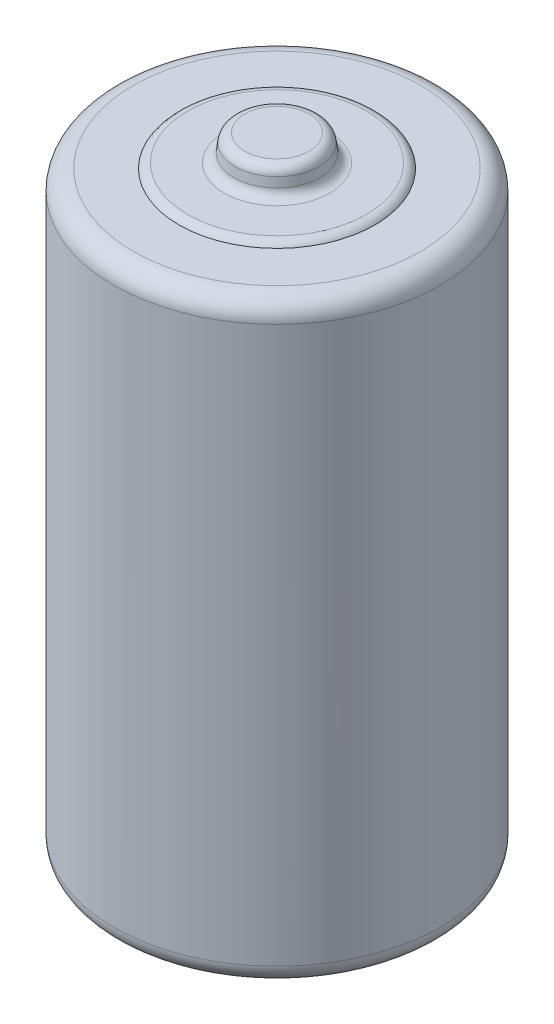
from build123d import *

# Parameters (mm, degrees)
SKETCH2_R      = 12.7
SKETCH2_R_2    = 7.62
EXTRUDE1_DEPTH = 0.381
EXTRUDE2_START = -0.9652
SKETCH3_R      = 12.7
SKETCH3_R_2    = 9.1186
EXTRUDE2_DEPTH = 0.9652
SKETCH4_R      = 5.08
SKETCH4_R_2    = 3.81
EXTRUDE3_DEPTH = 0.381
FILLET1_R      = 1.524
FILLET2_R      = 0.762
FILLET3_R      = 0.635


with BuildPart() as part:
    # Sketch1 → Revolve1 (revolve)
    with BuildSketch(Plane.XY, mode=Mode.PRIVATE) as revolve1_sk:
        Polygon((0, 0), (-12.7, 0), (-12.7, 47.625), (-3.429, 47.625), (-3.175, 49.657), (0, 49.657), align=None)
    revolve(revolve1_sk.sketch.rotate(Axis((0, 0, 0), (0, 1, 0)), 270), axis=Axis((0, 0, 0), (0, 1, 0)))

    # Sketch2 → Extrude1 (cut)
    with BuildSketch(Plane(origin=(0, 47.625, 0), x_dir=(1, 0, 0), z_dir=(0, 1, 0))):
        with Locations(Location((0, 0, 0), (0, 0, 90))):
            Circle(SKETCH2_R)
        with Locations(Location((0, 0, 0), (0, 0, 270))):
            Circle(SKETCH2_R_2, mode=Mode.SUBTRACT)
    extrude(amount=-EXTRUDE1_DEPTH, mode=Mode.SUBTRACT)

    # Sketch3 → Extrude2 (cut)
    with BuildSketch(Plane.XZ.offset(EXTRUDE2_START)):
        with Locations(Location((0, 0, 0), (0, 0, 270))):
            Circle(SKETCH3_R)
        with Locations(Location((0, 0, 0), (0, 0, 270))):
            Circle(SKETCH3_R_2, mode=Mode.SUBTRACT)
    extrude(amount=EXTRUDE2_DEPTH, mode=Mode.SUBTRACT)

    # Sketch4 → Extrude3 (cut)
    with BuildSketch(Plane.XZ):
        with Locations(Location((0, 0, 0), (0, 0, 270))):
            Circle(SKETCH4_R)
        with Locations(Location((0, 0, 0), (0, 0, 270))):
            Circle(SKETCH4_R_2, mode=Mode.SUBTRACT)
    extrude(amount=-EXTRUDE3_DEPTH, mode=Mode.SUBTRACT)

    # Fillet1
    # the kernel refuses this fillet: 1.524 mm, written as the material it takes off along each edge
    with BuildSketch(Plane(origin=(0, 47.244, 0), x_dir=(0, 0, -1), z_dir=(1, 0, 0))) as fillet1_piece_1:
        with BuildLine():
            CenterArc((12.7 - FILLET1_R, -FILLET1_R), FILLET1_R, 0, 90)
            Line((12.7 - FILLET1_R, 0), (12.7 - FILLET1_R, FILLET1_R * 0.02))
            Line((12.7 - FILLET1_R, FILLET1_R * 0.02), (12.7 + FILLET1_R * 0.02, FILLET1_R * 0.02))
            Line((12.7 + FILLET1_R * 0.02, FILLET1_R * 0.02), (12.7 + FILLET1_R * 0.02, -FILLET1_R))
            Line((12.7 + FILLET1_R * 0.02, -FILLET1_R), (12.7, -FILLET1_R))
        make_face()
    revolve(axis=Axis((0, 47.244, 0), (0, 1, 0)), mode=Mode.SUBTRACT)
    with BuildSketch(Plane(origin=(0, 0.9652, 0), x_dir=(0, 0, -1), z_dir=(-1, 0, 0))) as fillet1_piece_2:
        with BuildLine():
            CenterArc((12.7 - FILLET1_R, -FILLET1_R), FILLET1_R, 0, 90)
            Line((12.7, -FILLET1_R), (12.7 + FILLET1_R * 0.02, -FILLET1_R))
            Line((12.7 + FILLET1_R * 0.02, -FILLET1_R), (12.7 + FILLET1_R * 0.02, FILLET1_R * 0.02))
            Line((12.7 + FILLET1_R * 0.02, FILLET1_R * 0.02), (12.7 - FILLET1_R, FILLET1_R * 0.02))
            Line((12.7 - FILLET1_R, FILLET1_R * 0.02), (12.7 - FILLET1_R, 0))
        make_face()
    revolve(axis=Axis((0, 0.9652, 0), (0, -1, 0)), mode=Mode.SUBTRACT)
    with BuildSketch(Plane(origin=(0, 0, 0), x_dir=(0, 0, -1), z_dir=(-1, 0, 0))) as fillet1_piece_3:
        with BuildLine():
            CenterArc((7.700742969, -1.524), FILLET1_R, 21.510188267, 68.489811733)
            Line((9.1186, -0.9652), (9.146957141, -0.954024))
            ThreePointArc((9.146957141, -0.954024), (9.14908, -0.4826), (9.14908, 0))
            Line((9.14908, 0), (9.1186, 0.03048))
            Line((9.1186, 0.03048), (7.700742969, 0.03048))
            Line((7.700742969, 0.03048), (7.700742969, 0))
        make_face()
    revolve(axis=Axis((0, 0, 0), (0, -1, 0)), mode=Mode.SUBTRACT)

    # Fillet2
    # the kernel refuses this fillet: 0.762 mm, written as the material it adds along each edge
    with BuildSketch(Plane(origin=(0, 47.625, 0), x_dir=(0, 0, -1), z_dir=(1, 0, 0))) as fillet2_piece_1:
        with BuildLine():
            CenterArc((3.429 + FILLET2_R * 0.882782218537, FILLET2_R), FILLET2_R, 187.125016349, 82.874983651)
            Line((3.429 - FILLET2_R * 0.109495658176, FILLET2_R * 0.875965265411), (3.429, 0))
            Line((3.429, 0), (3.429 + FILLET2_R * 0.882782218537, 0))
        make_face()
    revolve(axis=Axis((0, 47.625, 0), (0, 1, 0)))
    # the kernel refuses this fillet: 0.762 mm, written as the material it takes off along each edge
    with BuildSketch(Plane(origin=(0, 47.625, 0), x_dir=(0, 0, 1), z_dir=(-1, 0, 0))) as fillet2_2_piece_1:
        with BuildLine():
            CenterArc((6.960088642, -0.762), FILLET2_R, 30, 60)
            Line((6.960088642, 0), (7.62, 0))
            Line((7.62, 0), (7.62, -0.381))
        make_face()
    revolve(axis=Axis((0, 47.625, 0), (0, 1, 0)), mode=Mode.SUBTRACT)
    with BuildSketch(Plane(origin=(0, 49.657, 0), x_dir=(0, 0, -1), z_dir=(1, 0, 0))) as fillet2_2_piece_2:
        with BuildLine():
            CenterArc((3.175 - FILLET2_R * 0.882782218537, -FILLET2_R), FILLET2_R, 7.125016349, 82.874983651)
            Line((3.175 - FILLET2_R * 0.882782218537, 0), (3.175, 0))
            Line((3.175, 0), (3.175 + FILLET2_R * 0.109495658176, -FILLET2_R * 0.875965265411))
        make_face()
    revolve(axis=Axis((0, 49.657, 0), (0, 1, 0)), mode=Mode.SUBTRACT)

    # Fillet3
    # the kernel refuses this fillet: 0.635 mm, written as the material it adds along each edge
    with BuildSketch(Plane(origin=(0, 0.381, 0), x_dir=(0, 0, -1), z_dir=(-1, 0, 0))) as fillet3_piece_1:
        with BuildLine():
            CenterArc((4.498012887, 0.635), FILLET3_R, 270, 66.421821522)
            Line((4.498012887, 0), (4.498012887, -0.0127))
            Line((4.498012887, -0.0127), (5.08, -0.0127))
            Line((5.08, -0.0127), (5.0927, 0))
            ThreePointArc((5.0927, 0), (5.0927, 0.1905), (5.091639742, 0.37592))
            Line((5.091639742, 0.37592), (5.08, 0.381))
        make_face()
    revolve(axis=Axis((0, 0.381, 0), (0, -1, 0)))
    with BuildSketch(Plane(origin=(0, 0.381, 0), x_dir=(0, 0, -1), z_dir=(-1, 0, 0))) as fillet3_piece_2:
        with BuildLine():
            CenterArc((4.391987113, 0.635), FILLET3_R, 203.578178478, 66.421821522)
            Line((3.81, 0.381), (3.798360258, 0.37592))
            ThreePointArc((3.798360258, 0.37592), (3.7973, 0.1905), (3.7973, 0))
            Line((3.7973, 0), (3.81, -0.0127))
            Line((3.81, -0.0127), (4.391987113, -0.0127))
            Line((4.391987113, -0.0127), (4.391987113, 0))
        make_face()
    revolve(axis=Axis((0, 0.381, 0), (0, -1, 0)))


solid = part.part
